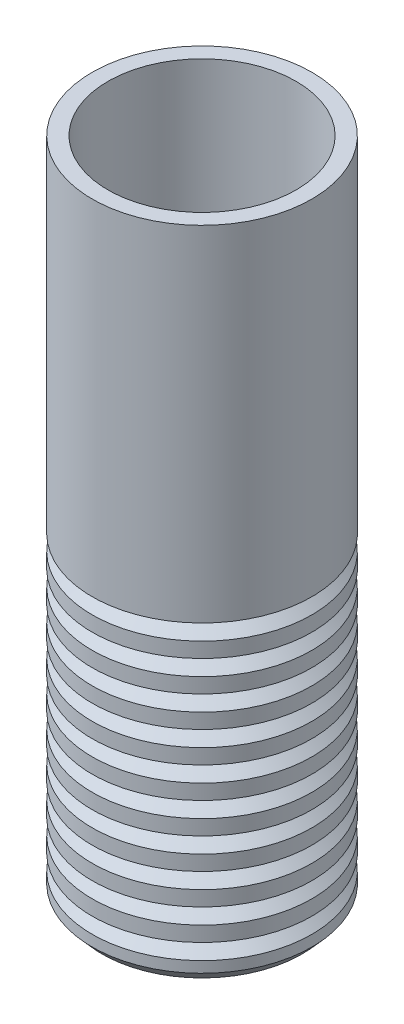
from build123d import *


with BuildPart() as part:
    # Sketch2 → Revolve1 (revolve)
    with BuildSketch(Plane.XY):
        Polygon((-3, 21), (-3, 11), (-1.25, 10.2), (-1.25, 0), (-3.19, 0), (-3.502181555, 0.35), (-3.502181555, 0.7), (-2.941610319, 1.2), (-3.502181555, 1.2), (-3.502181555, 1.68), (-2.941610319, 2.18), (-3.502181555, 2.18), (-3.502181555, 2.66), (-2.941610319, 3.16), (-3.502181555, 3.16), (-3.502181555, 3.64), (-2.941610319, 4.14), (-3.502181555, 4.14), (-3.502181555, 4.62), (-2.941610319, 5.12), (-3.502181555, 5.12), (-3.502181555, 5.6), (-2.941610319, 6.1), (-3.502181555, 6.1), (-3.502181555, 6.58), (-2.941610319, 7.08), (-3.502181555, 7.08), (-3.502181555, 7.56), (-2.941610319, 8.06), (-3.502181555, 8.06), (-3.502181555, 8.54), (-2.941610319, 9.04), (-3.502181555, 9.04), (-3.502181555, 9.52), (-2.941610319, 10.02), (-3.502181555, 10.02), (-3.502181555, 21), align=None)
    revolve(axis=Axis((0, 0, 0), (0, 1, 0)))


solid = part.part
